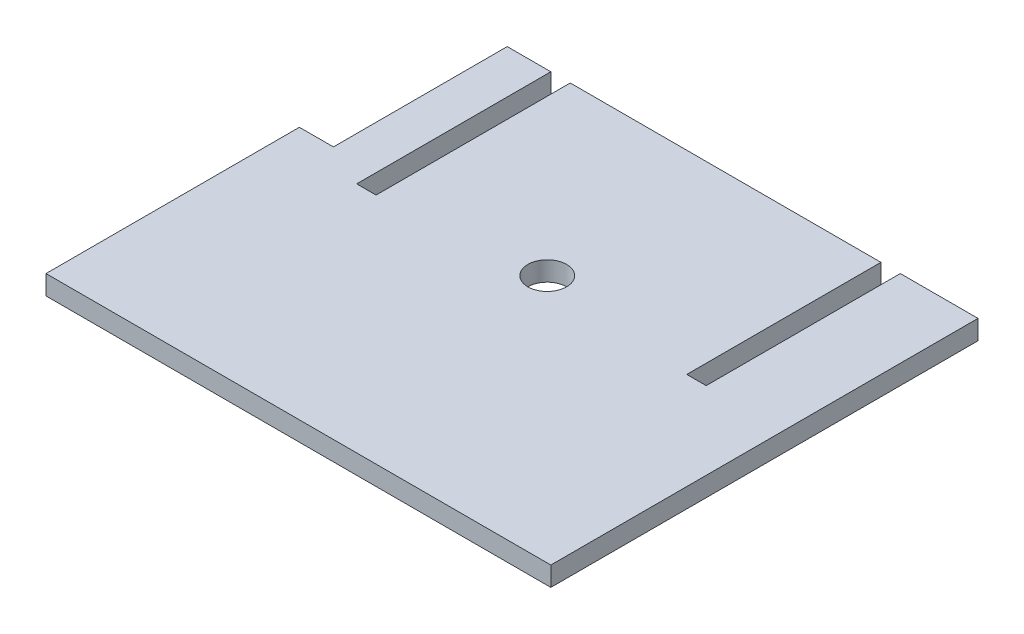
from build123d import *

# Parameters (mm, degrees)
BOSS_EXTRUDE1_DEPTH = 6.35
CAVITY1_START       = 298.45
CAVITY1_OUTLINE_R   = 12.7
CAVITY1_DEPTH       = 12.7
CAVITY1_START_2     = 720.91620239
CAVITY1_2_DEPTH     = 22.43918751
SKETCH2_W           = 22.270177668
SKETCH2_H           = 113.672619585
CUT_EXTRUDE1_DEPTH  = 1143.349273427


# Read off the part's stored shape, not the designer's step: Cavity1
with BuildPart() as part:
    # Sketch1 → Boss-Extrude1 (new, symmetric)
    with BuildSketch(Plane(origin=(0, 304.8, 0), x_dir=(1, 0, 0), z_dir=(0, 1, 0))):
        Polygon((798.4, -133.35), (1001.6, -133.35), (1001.6, -260.35), (1014.3, -260.35), (1014.3, -133.35), (1065.1, -133.35), (1065.1, -412.75), (1014.3, -412.75), (1001.6, -412.75), (798.4, -412.75), (785.7, -412.75), (734.9, -412.75), (734.9, -133.35), (785.7, -133.35), (785.7, -260.35), (798.4, -260.35), align=None)
    extrude(amount=BOSS_EXTRUDE1_DEPTH, both=True)

    # Cavity1 outline → Cavity1 (cut)
    with BuildSketch(Plane(origin=(0, 0, 0), x_dir=(1, 0, 0), z_dir=(0, 1, 0)).offset(CAVITY1_START)):
        with Locations((900, -250)):
            Circle(CAVITY1_OUTLINE_R)
    extrude(amount=CAVITY1_DEPTH, mode=Mode.SUBTRACT)

    # Cavity1 2 outline → Cavity1 2 (cut)
    with BuildSketch(Plane(origin=(0, 0, 0), x_dir=(0.7149295353100829, -0.698752516444498, 0.02491345627949748), z_dir=(0.6991965099607612, 0.7144755512387372, -0.025474048378572107)).offset(CAVITY1_START_2)):
        with BuildLine():
            Line((312, -255.374549574), (314.076314529, -255.435688643))
            ThreePointArc((314.076314529, -255.435688643), (327.146171675, -242.424687318), (313.444242413, -230.081087528))
            Line((313.444242413, -230.081087528), (312, -230.195835843))
            Line((312, -230.195835843), (312, -255.374549574))
        make_face()
    extrude(amount=CAVITY1_2_DEPTH, mode=Mode.SUBTRACT)

    # Sketch2 → Cut-Extrude1 (cut, through all)
    with BuildSketch(Plane(origin=(0, 311.15, 0), x_dir=(1, 0, 0), z_dir=(0, 1, 0))):
        with Locations((746.035088834, -190.186309793)):
            Rectangle(SKETCH2_W, SKETCH2_H)
    extrude(amount=-CUT_EXTRUDE1_DEPTH, mode=Mode.SUBTRACT)


solid = part.part
